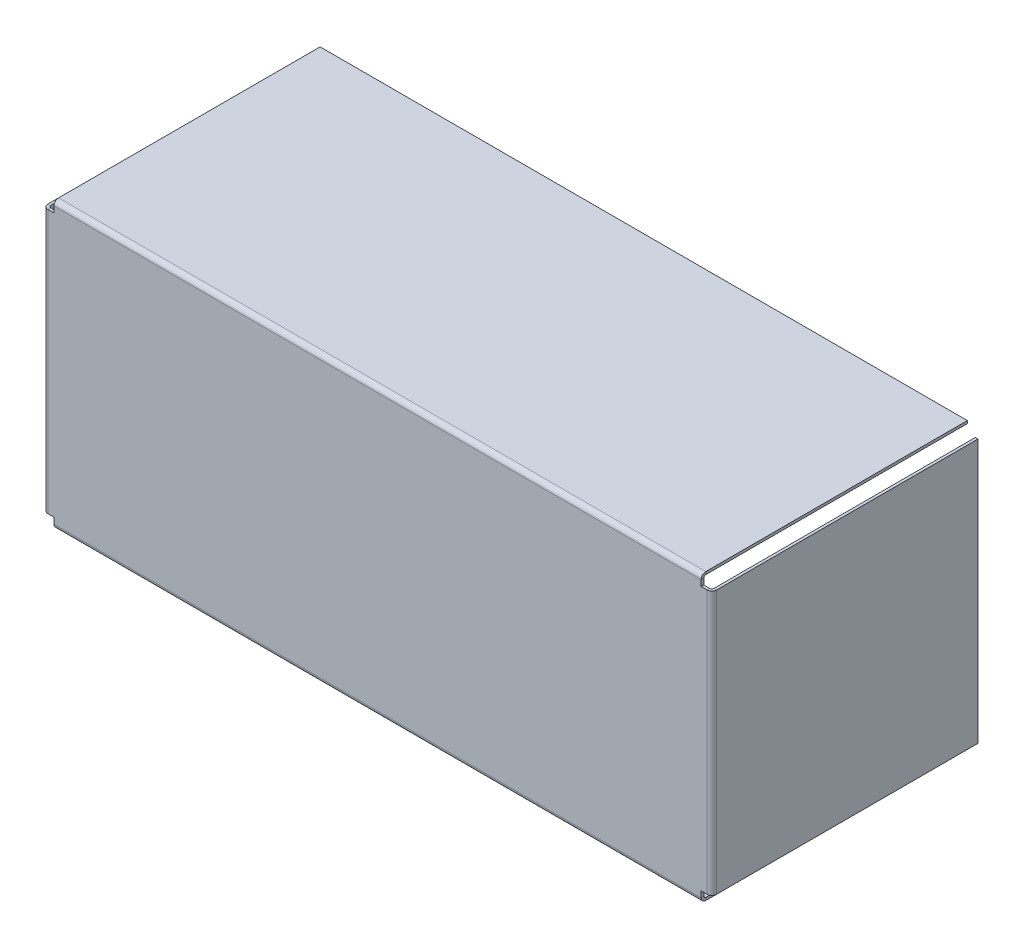
from build123d import *

# Parameters (mm, degrees)
SM_START                         = -1
SM_BASE_FLANGE_1_DEPTH           = 1
SM_EDGE_FLANGE_1_STRIP_W         = 5.4732
SM_EDGE_FLANGE_1_STRIP_H         = 1
SM_EDGE_FLANGE_1_STRIP_CUT_DEPTH = 243.159735698
SM_EDGE_FLANGE_1_DEPTH           = 243.159735698
SM_EDGE_FLANGE_2_STRIP_W         = 5.4732
SM_EDGE_FLANGE_2_STRIP_H         = 1
SM_EDGE_FLANGE_2_STRIP_CUT_DEPTH = 99.02081528
SM_EDGE_FLANGE_2_DEPTH           = 99.02081528
SM_EDGE_FLANGE_3_STRIP_W         = 5.4732
SM_EDGE_FLANGE_3_STRIP_H         = 1
SM_EDGE_FLANGE_3_STRIP_CUT_DEPTH = 99.02081528
SM_EDGE_FLANGE_3_DEPTH           = 99.02081528
SM_EDGE_FLANGE_4_STRIP_W         = 5.4732
SM_EDGE_FLANGE_4_STRIP_H         = 1
SM_EDGE_FLANGE_4_STRIP_CUT_DEPTH = 243.159735698
SM_EDGE_FLANGE_4_DEPTH           = 243.159735698
CUT_EXTRUDE_1_REACH              = 277.58
SKETCH_18_R                      = 16.639768722


# Read off the part's stored shape, not the designer's step: Базовая кромка1
# Sheet-metal steps are written as plain solids
with BuildPart() as part:
    # Базовая кромка1 outline → Базовая кромка1 (new body)
    with BuildSketch(Plane.XY.offset(SM_START)):
        Polygon((-121.579867849, 49.51040764), (-125.579867849, 49.51040764), (-125.579867849, -49.51040764), (-121.579867849, -49.51040764), (-121.579867849, -53.51040764), (121.579867849, -53.51040764), (121.579867849, -49.51040764), (125.579867849, -49.51040764), (125.579867849, 49.51040764), (121.579867849, 49.51040764), (121.579867849, 53.51040764), (-121.579867849, 53.51040764), align=None)
    extrude(amount=SM_BASE_FLANGE_1_DEPTH)

    # Ребро-кромка1 strip (across the edge) → Ребро-кромка1 strip cut (cut)
    with BuildSketch(Plane(origin=(-121.579867849, 53.51040764, -1), x_dir=(0, -1, 0), z_dir=(1, 0, 0))):
        with Locations((-1, -0.5)):
            Rectangle(SM_EDGE_FLANGE_1_STRIP_W, SM_EDGE_FLANGE_1_STRIP_H)
    extrude(amount=SM_EDGE_FLANGE_1_STRIP_CUT_DEPTH, mode=Mode.SUBTRACT)

    # Ребро-кромка1 section (across the edge) → Ребро-кромка1 (add)
    with BuildSketch(Plane(origin=(-121.579867849, 53.51040764, -1), x_dir=(0, -1, 0), z_dir=(1, 0, 0))):
        with BuildLine():
            Line((0, 0.7366), (0, 99))
            Line((0, 99), (1, 99))
            Line((1, 99), (1, 0.7366))
            ThreePointArc((1, 0.7366), (1.215745145, 0.215745145), (1.7366, 0))
            Line((1.7366, 0), (1.7366, -1))
            ThreePointArc((1.7366, -1), (0.508638364, -0.491361636), (0, 0.7366))
        make_face()
    extrude(amount=SM_EDGE_FLANGE_1_DEPTH)

    # Ребро-кромка2 strip (across the edge) → Ребро-кромка2 strip cut (cut)
    with BuildSketch(Plane(origin=(-125.579867849, -49.51040764, -1), x_dir=(1, 0, 0), z_dir=(0, 1, 0))):
        with Locations((-1, -0.5)):
            Rectangle(SM_EDGE_FLANGE_2_STRIP_W, SM_EDGE_FLANGE_2_STRIP_H)
    extrude(amount=SM_EDGE_FLANGE_2_STRIP_CUT_DEPTH, mode=Mode.SUBTRACT)

    # Ребро-кромка2 section (across the edge) → Ребро-кромка2 (add)
    with BuildSketch(Plane(origin=(-125.579867849, -49.51040764, -1), x_dir=(1, 0, 0), z_dir=(0, 1, 0))):
        with BuildLine():
            Line((0, 0.7366), (0, 99))
            Line((0, 99), (1, 99))
            Line((1, 99), (1, 0.7366))
            ThreePointArc((1, 0.7366), (1.215745145, 0.215745145), (1.7366, 0))
            Line((1.7366, 0), (1.7366, -1))
            ThreePointArc((1.7366, -1), (0.508638364, -0.491361636), (0, 0.7366))
        make_face()
    extrude(amount=SM_EDGE_FLANGE_2_DEPTH)

    # Ребро-кромка3 strip (across the edge) → Ребро-кромка3 strip cut (cut)
    with BuildSketch(Plane(origin=(125.579867849, 49.51040764, -1), x_dir=(-1, 0, 0), z_dir=(0, -1, 0))):
        with Locations((-1, -0.5)):
            Rectangle(SM_EDGE_FLANGE_3_STRIP_W, SM_EDGE_FLANGE_3_STRIP_H)
    extrude(amount=SM_EDGE_FLANGE_3_STRIP_CUT_DEPTH, mode=Mode.SUBTRACT)

    # Ребро-кромка3 section (across the edge) → Ребро-кромка3 (add)
    with BuildSketch(Plane(origin=(125.579867849, 49.51040764, -1), x_dir=(-1, 0, 0), z_dir=(0, -1, 0))):
        with BuildLine():
            Line((0, 0.7366), (0, 99))
            Line((0, 99), (1, 99))
            Line((1, 99), (1, 0.7366))
            ThreePointArc((1, 0.7366), (1.215745145, 0.215745145), (1.7366, 0))
            Line((1.7366, 0), (1.7366, -1))
            ThreePointArc((1.7366, -1), (0.508638364, -0.491361636), (0, 0.7366))
        make_face()
    extrude(amount=SM_EDGE_FLANGE_3_DEPTH)

    # Ребро-кромка4 strip (across the edge) → Ребро-кромка4 strip cut (cut)
    with BuildSketch(Plane(origin=(121.579867849, -53.51040764, -1), x_dir=(0, 1, 0), z_dir=(-1, 0, 0))):
        with Locations((-1, -0.5)):
            Rectangle(SM_EDGE_FLANGE_4_STRIP_W, SM_EDGE_FLANGE_4_STRIP_H)
    extrude(amount=SM_EDGE_FLANGE_4_STRIP_CUT_DEPTH, mode=Mode.SUBTRACT)

    # Ребро-кромка4 section (across the edge) → Ребро-кромка4 (add)
    with BuildSketch(Plane(origin=(121.579867849, -53.51040764, -1), x_dir=(0, 1, 0), z_dir=(-1, 0, 0))):
        with BuildLine():
            Line((0, 0.7366), (0, 99))
            Line((0, 99), (1, 99))
            Line((1, 99), (1, 0.7366))
            ThreePointArc((1, 0.7366), (1.215745145, 0.215745145), (1.7366, 0))
            Line((1.7366, 0), (1.7366, -1))
            ThreePointArc((1.7366, -1), (0.508638364, -0.491361636), (0, 0.7366))
        make_face()
    extrude(amount=SM_EDGE_FLANGE_4_DEPTH)

    # Эскиз18 → Вырез-Вытянуть1 (cut, up to next)
    with BuildSketch(Plane.ZY.offset(125.579867849), mode=Mode.PRIVATE) as cut_extrude_1_sk1:
        with Locations((-67.065719066, -8.85501242)):
            Circle(SKETCH_18_R)
    cut_extrude_1_tool1 = extrude(cut_extrude_1_sk1.sketch, amount=-CUT_EXTRUDE_1_REACH, mode=Mode.PRIVATE) & part.part
    add(cut_extrude_1_tool1.solids().sort_by_distance((-125.579868, -8.855012, -67.065719))[0], mode=Mode.SUBTRACT)


solid = part.part
